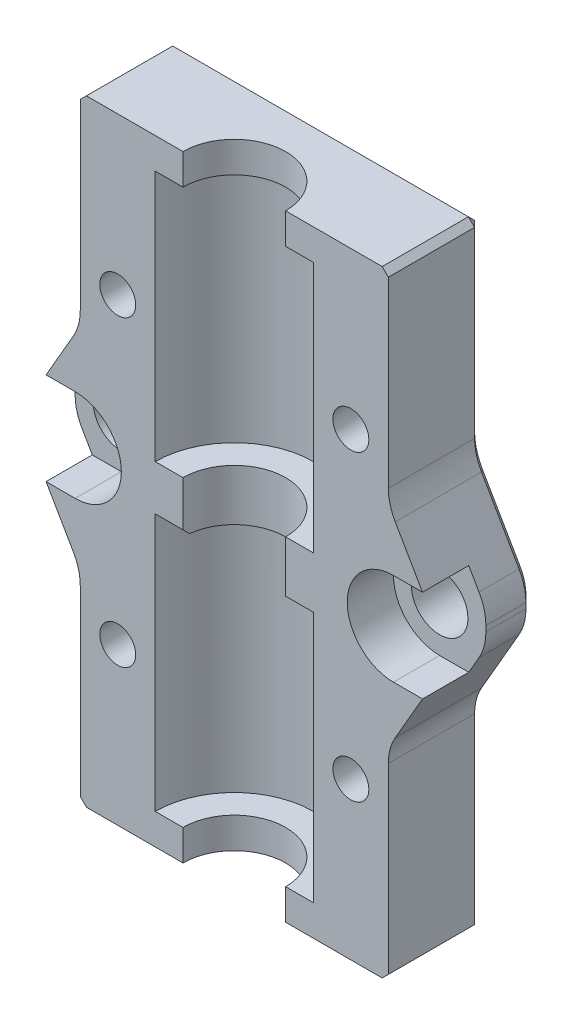
from build123d import *

# Parameters (mm, degrees)
ESBO_O1_W                    = 30
ESBO_O1_H                    = 60
RESSALTO_EXTRUS_O1_DEPTH     = 4.5
CORTE_EXTRUS_O2_DEPTH        = 63.010079826
CORTE_EXTRUS_O3_START        = -24.5
CORTE_EXTRUS_O3_DEPTH        = 24.5
ESBO_O4_W                    = 9
ESBO_O4_H                    = 24
RESSALTO_EXTRUS_O3_DEPTH     = 5
CHANFRO1_SIZE                = 6
CHANFRO1_SIZE_2              = 10.392304845
FILETE2_R                    = 5
CHANFRO1_OF_ESPELHAR2_SIZE   = 6
CHANFRO1_OF_ESPELHAR2_SIZE_2 = 10.392304845
FILETE3_R                    = 5
ESBO_O5_R                    = 2.75
CORTE_EXTRUS_O4_DEPTH        = 38.161808352
ESBO_O6_R                    = 4.5
ESBO_O6_R_2                  = 2.75
CORTE_EXTRUS_O5_DEPTH        = 4.5
ESBO_O7_R                    = 1.75
CORTE_EXTRUS_O6_DEPTH        = 38.161808352
ESPELHAR4_COPY_1_SKETCH_R    = 1.75
ESPELHAR4_COPY_1_DEPTH       = 38.161808352
CHANFRO2_SIZE                = 0.6


with BuildPart() as part:
    # Esboço1 → Ressalto-extrusão1 (new, symmetric)
    with BuildSketch(Plane.XY):
        Rectangle(ESBO_O1_W, ESBO_O1_H)
    extrude(amount=RESSALTO_EXTRUS_O1_DEPTH, both=True)

    # Esboço2 → Corte-extrusão2 (cut, through all)
    with BuildSketch(Plane.XZ.offset(30)):
        with BuildLine():
            Line((-5, 58.363424399), (-5, 4.5))
            ThreePointArc((-5, 4.5), (0, -0.5), (5, 4.5))
            Line((5, 4.5), (5, 58.363424399))
            Line((5, 58.363424399), (5, 166.090273197))
            Line((5, 166.090273197), (-5, 166.090273197))
            Line((-5, 166.090273197), (-5, 58.363424399))
        make_face()
    extrude(amount=-CORTE_EXTRUS_O2_DEPTH, mode=Mode.SUBTRACT)

    # Esboço3 → Corte-extrusão3 (cut)
    with BuildSketch(Plane(origin=(0, 27, 0), x_dir=(1, 0, 0), z_dir=(0, 1, 0)).offset(CORTE_EXTRUS_O3_START)):
        with BuildLine():
            ThreePointArc((-5, -4.5), (0, 0.5), (5, -4.5))
            Line((5, -4.5), (7.7, -4.5))
            ThreePointArc((7.7, -4.5), (0, 3.2), (-7.7, -4.5))
            Line((-7.7, -4.5), (-5, -4.5))
        make_face()
    corte_extrus_o3 = extrude(amount=CORTE_EXTRUS_O3_DEPTH, mode=Mode.SUBTRACT)

    # Espelhar1: Corte-extrusão3 across plane
    add(corte_extrus_o3.mirror(Plane.ZX), mode=Mode.SUBTRACT)

    # Esboço4 → Ressalto-extrusão3 (add)
    with BuildSketch(Plane(origin=(15, 0, 0), x_dir=(0, 0, -1), z_dir=(1, 0, 0))):
        Rectangle(ESBO_O4_W, ESBO_O4_H)
    ressalto_extrus_o3 = extrude(amount=RESSALTO_EXTRUS_O3_DEPTH)

    # Chanfro1
    # the kernel refuses this chamfer: 10.392304845, 6 mm, written as the material it takes off along each edge
    with BuildSketch(Plane(origin=(20, 12, -31.385783824), x_dir=(-0.9983227437537926, 0.05789386240267147, 0), z_dir=(0, 0, 1))) as chanfro1_piece_1_section:
        Polygon((CHANFRO1_SIZE * 0.998322743754, CHANFRO1_SIZE * 0.0578938624027), (-CHANFRO1_SIZE_2 * 0.057893862405, CHANFRO1_SIZE_2 * 0.998322743793), (0, 0), align=None)
    chanfro1_piece_1 = extrude(amount=62.771567647, mode=Mode.PRIVATE)
    chanfro1_piece_1 = split(chanfro1_piece_1, bisect_by=Plane(origin=(15, 8.382110688, 0), z_dir=(1, 0, 0)), keep=Keep.TOP, mode=Mode.PRIVATE)
    add(chanfro1_piece_1, mode=Mode.SUBTRACT)
    with BuildSketch(Plane(origin=(20, -12, 31.385783824), x_dir=(-0.9983227437537926, -0.05789386240267147, 0), z_dir=(0, 0, -1))) as chanfro1_piece_2_section:
        Polygon((CHANFRO1_SIZE * 0.998322743754, CHANFRO1_SIZE * 0.0578938624027), (-CHANFRO1_SIZE_2 * 0.057893862405, CHANFRO1_SIZE_2 * 0.998322743793), (0, 0), align=None)
    chanfro1_piece_2 = extrude(amount=62.771567647, mode=Mode.PRIVATE)
    chanfro1_piece_2 = split(chanfro1_piece_2, bisect_by=Plane(origin=(15, -8.382110688, 0), z_dir=(1, 0, 0)), keep=Keep.TOP, mode=Mode.PRIVATE)
    add(chanfro1_piece_2, mode=Mode.SUBTRACT)

    # Filete2
    filete2_edges = [part.edges().sort_by_distance(p)[0] for p in [
        (20, -1.607695155, 0),
        (20, 1.607695155, 0),
        (15, 10.267949192, 0),
        (15, -10.267949192, 0),
    ]]
    fillet(filete2_edges, radius=FILETE2_R)

    # Espelhar2: Ressalto-extrusão3 across plane
    add(ressalto_extrus_o3.mirror(Plane(origin=(0, 0, 0), x_dir=(0, 0, 1), z_dir=(1, 0, 0))))

    # Chanfro1 of Espelhar2
    # the kernel refuses this chamfer: 10.392304845, 6 mm, written as the material it takes off along each edge
    with BuildSketch(Plane(origin=(-20, 12, -31.385783824), x_dir=(0.9983227437537926, 0.05789386240267147, 0), z_dir=(0, 0, 1))) as chanfro1_of_espelhar2_piece_1_section:
        Polygon((CHANFRO1_OF_ESPELHAR2_SIZE * 0.998322743754, -CHANFRO1_OF_ESPELHAR2_SIZE * 0.0578938624027), (-CHANFRO1_OF_ESPELHAR2_SIZE_2 * 0.057893862405, -CHANFRO1_OF_ESPELHAR2_SIZE_2 * 0.998322743793), (0, 0), align=None)
    chanfro1_of_espelhar2_piece_1 = extrude(amount=62.771567647, mode=Mode.PRIVATE)
    chanfro1_of_espelhar2_piece_1 = split(chanfro1_of_espelhar2_piece_1, bisect_by=Plane(origin=(-15, 8.382110688, 0), z_dir=(-1, 0, 0)), keep=Keep.TOP, mode=Mode.PRIVATE)
    add(chanfro1_of_espelhar2_piece_1, mode=Mode.SUBTRACT)
    with BuildSketch(Plane(origin=(-20, -12, 31.385783824), x_dir=(0.9983227437537926, -0.05789386240267147, 0), z_dir=(0, 0, -1))) as chanfro1_of_espelhar2_piece_2_section:
        Polygon((CHANFRO1_OF_ESPELHAR2_SIZE * 0.998322743754, -CHANFRO1_OF_ESPELHAR2_SIZE * 0.0578938624027), (-CHANFRO1_OF_ESPELHAR2_SIZE_2 * 0.057893862405, -CHANFRO1_OF_ESPELHAR2_SIZE_2 * 0.998322743793), (0, 0), align=None)
    chanfro1_of_espelhar2_piece_2 = extrude(amount=62.771567647, mode=Mode.PRIVATE)
    chanfro1_of_espelhar2_piece_2 = split(chanfro1_of_espelhar2_piece_2, bisect_by=Plane(origin=(-15, -8.382110688, 0), z_dir=(-1, 0, 0)), keep=Keep.TOP, mode=Mode.PRIVATE)
    add(chanfro1_of_espelhar2_piece_2, mode=Mode.SUBTRACT)

    # Filete3
    filete3_edges = [part.edges().sort_by_distance(p)[0] for p in [
        (-20, -1.607695155, 0),
        (-20, 1.607695155, 0),
        (-15, 10.267949192, 0),
        (-15, -10.267949192, 0),
    ]]
    fillet(filete3_edges, radius=FILETE3_R)

    # Esboço5 → Corte-extrusão4 (cut, through all)
    with BuildSketch(Plane.XY.offset(4.5)):
        with Locations((15.5, 0)):
            Circle(ESBO_O5_R)
    corte_extrus_o4 = extrude(amount=-CORTE_EXTRUS_O4_DEPTH, mode=Mode.SUBTRACT)

    # Esboço6 → Corte-extrusão5 (cut)
    # profile 1 of 3: a face of its own
    with BuildSketch(Plane.XY.offset(4.5)):
        with BuildLine():
            Line((18.330127019, 4.5), (15.5, 4.5))
            ThreePointArc((15.5, 4.5), (18.681980515, 3.181980515), (20, 0))
            Line((20, 0), (20, 0.267949192))
            ThreePointArc((20, 0.267949192), (19.829629131, 1.562044418), (19.330127019, 2.767949192))
            Line((19.330127019, 2.767949192), (18.330127019, 4.5))
        make_face()
    # profile 2 of 3: a face of its own
    with BuildSketch(Plane.XY.offset(4.5)):
        with Locations((15.5, 0)):
            Circle(ESBO_O6_R)
        with Locations((15.5, 0)):
            Circle(ESBO_O6_R_2, mode=Mode.SUBTRACT)
    # profile 3 of 3: a face of its own
    with BuildSketch(Plane.XY.offset(4.5)):
        with BuildLine():
            Line((20, -0.267949192), (20, 0))
            ThreePointArc((20, 0), (18.681980515, -3.181980515), (15.5, -4.5))
            Line((15.5, -4.5), (18.330127019, -4.5))
            Line((18.330127019, -4.5), (19.330127019, -2.767949192))
            ThreePointArc((19.330127019, -2.767949192), (19.829629131, -1.562044418), (20, -0.267949192))
        make_face()
    corte_extrus_o5 = extrude(amount=-CORTE_EXTRUS_O5_DEPTH, mode=Mode.SUBTRACT)

    # Espelhar5: Corte-extrusão4, Corte-extrusão5 across plane
    add(corte_extrus_o4.mirror(Plane(origin=(0, 0, 0), x_dir=(0, 0, 1), z_dir=(1, 0, 0))), mode=Mode.SUBTRACT)
    add(corte_extrus_o5.mirror(Plane(origin=(0, 0, 0), x_dir=(0, 0, 1), z_dir=(1, 0, 0))), mode=Mode.SUBTRACT)

    # Esboço7 → Corte-extrusão6 (cut, through all)
    with BuildSketch(Plane.XY.offset(4.5)):
        with Locations((11.35, 14.75)):
            Circle(ESBO_O7_R)
    corte_extrus_o6 = extrude(amount=-CORTE_EXTRUS_O6_DEPTH, mode=Mode.SUBTRACT)

    # Espelhar3: Corte-extrusão6 across plane
    add(corte_extrus_o6.mirror(Plane.ZX), mode=Mode.SUBTRACT)

    # Espelhar4: Corte-extrusão6 across plane
    add(corte_extrus_o6.mirror(Plane(origin=(0, 0, 0), x_dir=(0, 0, 1), z_dir=(1, 0, 0))), mode=Mode.SUBTRACT)

    # Espelhar4 copy 1 sketch → Espelhar4 copy 1 (cut, through all)
    with BuildSketch(Plane(origin=(0, 0, 4.5), x_dir=(-1, 0, 0), z_dir=(0, 0, 1))):
        with Locations((11.35, 14.75)):
            Circle(ESPELHAR4_COPY_1_SKETCH_R)
    extrude(amount=-ESPELHAR4_COPY_1_DEPTH, mode=Mode.SUBTRACT)

    # Chanfro2
    chanfro2_edges = [part.edges().sort_by_distance(p)[0] for p in [
        (17.5, 5.937822174, -4.5),
        (17.5, -5.937822174, -4.5),
        (20, 0, -4.5),
        (19.829629131, -1.562044418, -4.5),
        (19.829629131, 1.562044418, -4.5),
        (15.170370869, 10.313599929, -4.5),
        (15.170370869, -10.313599929, -4.5),
        (-15, -20.803847577, -4.5),
        (-17.5, -5.937822174, -4.5),
        (-17.5, 5.937822174, -4.5),
        (-20, 0, -4.5),
        (-19.829629131, -1.562044418, -4.5),
        (-19.829629131, 1.562044418, -4.5),
        (-15.170370869, -10.313599929, -4.5),
        (-15.170370869, 10.313599929, -4.5),
        (-6.35, -2.5, 4.5),
        (0, -30, -4.5),
        (-15, 20.803847577, -4.5),
        (0, 30, -4.5),
        (15, -20.803847577, -4.5),
        (15, -30, 0),
        (-15, -30, 0),
        (-15, 30, 0),
        (15, 30, 0),
        (15, 20.803847577, -4.5),
    ]]
    chamfer(chanfro2_edges, length=CHANFRO2_SIZE)


solid = part.part
